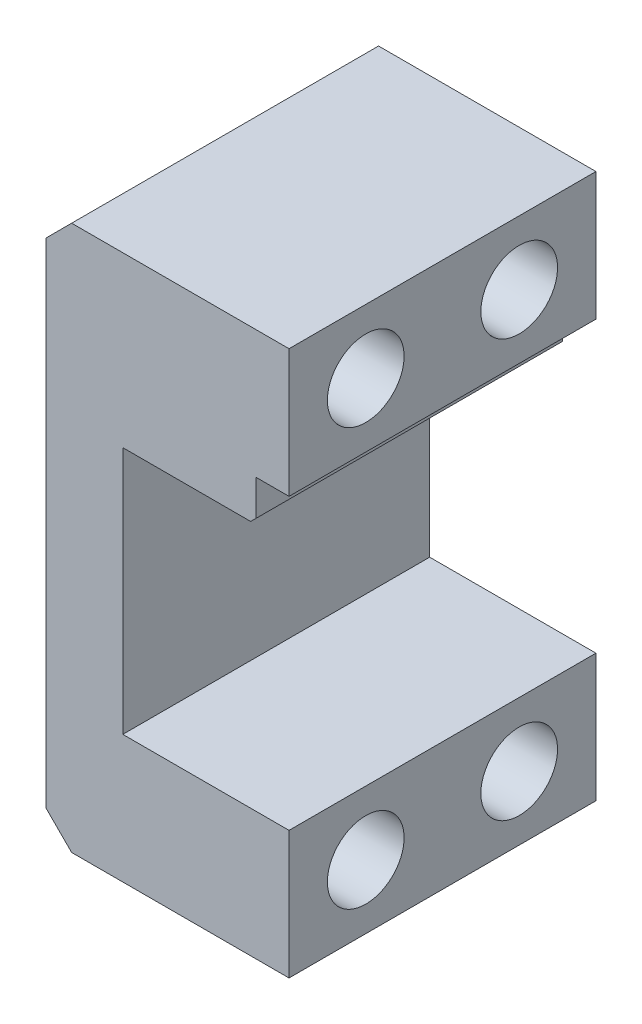
from build123d import *

# Parameters (mm, degrees)
EXTRUDE_1_DEPTH     = 12
CHAMFER_1_SIZE      = 0.2
SKETCH_2_R          = 1.5
CUT_EXTRUDE_1_DEPTH = 27.236731885
CHAMFER_2_SIZE      = 1


with BuildPart() as part:
    # 草图1 → 凸台-拉伸1 (new body)
    with BuildSketch(Plane.XY):
        Polygon((0, 0), (0, 21.31), (9.5, 21.31), (9.5, 16.31), (8.2, 16.31), (8.2, 14.71), (3, 14.71), (3, 5), (9.5, 5), (9.5, 0), align=None)
    extrude(amount=EXTRUDE_1_DEPTH)

    # 倒角1
    chamfer_1_edges = [part.edges().sort_by_distance(p)[0] for p in [
        (8.2, 14.71, 6),
    ]]
    chamfer(chamfer_1_edges, length=CHAMFER_1_SIZE)

    # 草图2 → 切除-拉伸1 (cut, through all)
    with BuildSketch(Plane.ZY):
        with Locations((9, 18.81)):
            Circle(SKETCH_2_R)
        with Locations((3, 18.81)):
            Circle(SKETCH_2_R)
        with Locations((3, 2.5)):
            Circle(SKETCH_2_R)
        with Locations((9, 2.5)):
            Circle(SKETCH_2_R)
    extrude(amount=-CUT_EXTRUDE_1_DEPTH, mode=Mode.SUBTRACT)

    # 倒角2
    chamfer_2_edges = [part.edges().sort_by_distance(p)[0] for p in [
        (0, 0, 6),
        (0, 21.31, 6),
    ]]
    chamfer(chamfer_2_edges, length=CHAMFER_2_SIZE - 0.0001)  # a hair under: the kernel refuses the full size


solid = part.part
